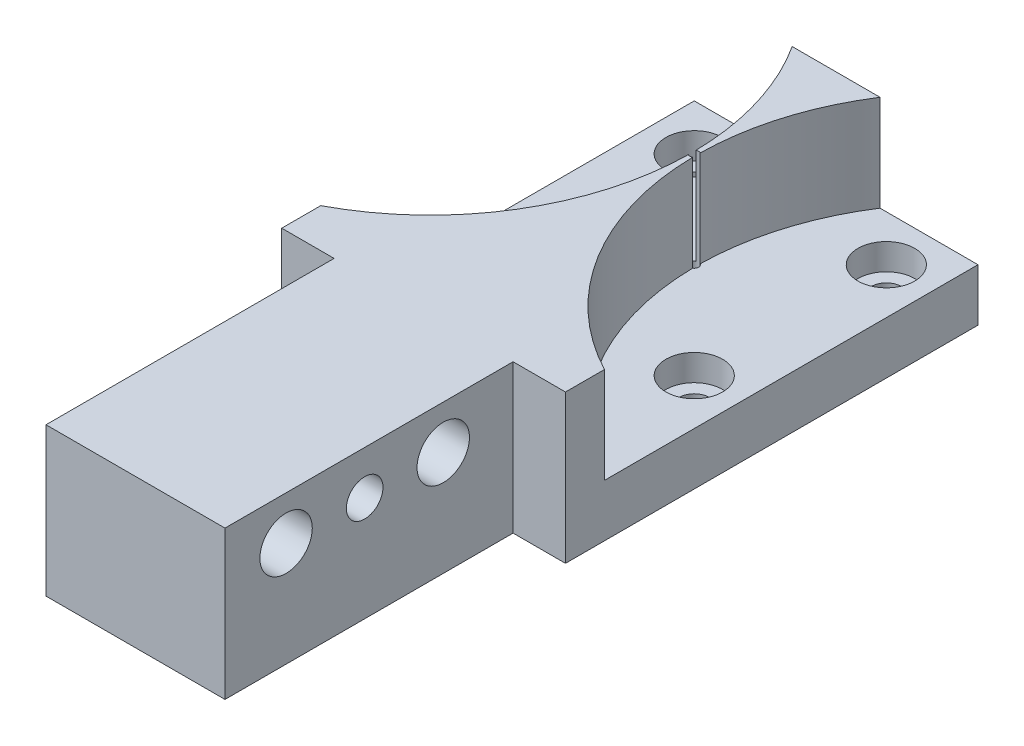
from build123d import *

# Parameters (mm, degrees)
SKETCH1_W                      = 32.5
SKETCH1_H                      = 80.25
BOSS_EXTRUDE1_DEPTH            = 6
BOSS_EXTRUDE2_DEPTH            = 11
F_6_0MM_DOWEL_HOLE1_D          = 6
M5X0_8_TAPPED_HOLE1_D          = 4.2
CBORE_FOR_M3_SHCS1_D           = 3.4
CBORE_FOR_M3_SHCS1_CBORE_D     = 6.5
CBORE_FOR_M3_SHCS1_CBORE_DEPTH = 3
F_1_0_1_DIAMETER_HOLE1_D       = 1
SKETCH12_R                     = 1.5
CUT_EXTRUDE1_DEPTH             = 5
SKETCH13_W                     = 6
SKETCH13_H                     = 33
CUT_EXTRUDE2_DEPTH             = 84.624906577


with BuildPart() as part:
    # Sketch1 → Boss-Extrude1 (new body)
    with BuildSketch(Plane(origin=(0, 0, 0), x_dir=(1, 0, 0), z_dir=(0, 1, 0))):
        with Locations((0, -40.125)):
            Rectangle(SKETCH1_W, SKETCH1_H)
    extrude(amount=-BOSS_EXTRUDE1_DEPTH)

    # Sketch2 → Boss-Extrude2 (add)
    with BuildSketch(Plane(origin=(0, 0, 0), x_dir=(1, 0, 0), z_dir=(0, 1, 0))):
        with BuildLine():
            Line((-5.032198748, 0), (5.032198748, 0))
            ThreePointArc((5.032198748, 0), (1.230950737, -23.858861929), (16.25, -42.782998323))
            Line((16.25, -42.782998323), (16.25, -80.25))
            Line((16.25, -80.25), (-16.25, -80.25))
            Line((-16.25, -80.25), (-16.25, -42.782998323))
            ThreePointArc((-16.25, -42.782998323), (-1.230950737, -23.858861929), (-5.032198748, 0))
        make_face()
    extrude(amount=BOSS_EXTRUDE2_DEPTH)

    # Ø6.0mm Dowel Hole1 (through all)
    with Locations(Plane(origin=(16.25, 0, 0), x_dir=(0, 0, -1), z_dir=(1, 0, 0))):
        with Locations((-73.25, 6), (-55.25, 6)):
            Hole(F_6_0MM_DOWEL_HOLE1_D / 2)

    # M5x0.8 Tapped Hole1 (through all)
    with Locations(Plane(origin=(16.25, 0, 0), x_dir=(0, 0, -1), z_dir=(1, 0, 0))):
        with Locations((-64.25, 6)):
            Hole(M5X0_8_TAPPED_HOLE1_D / 2)

    # CBORE for M3 SHCS1 (through all)
    with Locations(Plane(origin=(0, 0, 0), x_dir=(1, 0, 0), z_dir=(0, 1, 0))):
        with Locations((-11, -5.25), (11, -5.25), (11, -27.25), (-11, -27.25)):
            CounterBoreHole(CBORE_FOR_M3_SHCS1_D / 2, CBORE_FOR_M3_SHCS1_CBORE_D / 2, CBORE_FOR_M3_SHCS1_CBORE_DEPTH)

    # Ø1.0 (1) Diameter Hole1 (through all)
    with Locations(Plane(origin=(0, 11, 0), x_dir=(1, 0, 0), z_dir=(0, 1, 0))):
        with Locations((0, -16.25)):
            Hole(F_1_0_1_DIAMETER_HOLE1_D / 2)

    # Sketch12 → Cut-Extrude1 (cut)
    with BuildSketch(Plane.XZ.offset(6)):
        with Locations((0, 16.25)):
            Circle(SKETCH12_R)
    extrude(amount=-CUT_EXTRUDE1_DEPTH, mode=Mode.SUBTRACT)

    # Sketch13 → Cut-Extrude2 (cut, through all)
    with BuildSketch(Plane(origin=(0, 11, 0), x_dir=(1, 0, 0), z_dir=(0, 1, 0))):
        with Locations((-13.25, -63.75)):
            Rectangle(SKETCH13_W, SKETCH13_H)
        with Locations((13.25, -63.75)):
            Rectangle(SKETCH13_W, SKETCH13_H)
    extrude(amount=-CUT_EXTRUDE2_DEPTH, mode=Mode.SUBTRACT)


solid = part.part
